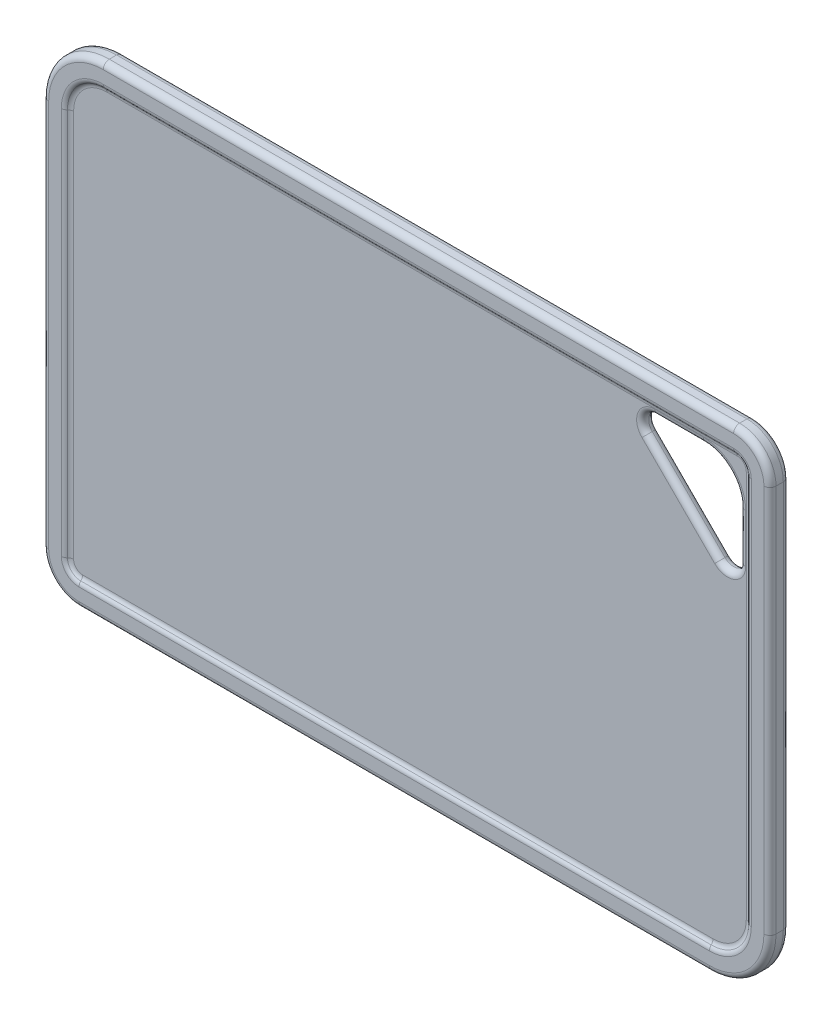
from build123d import *

# Parameters (mm, degrees)
SKETCH1_W           = 381
SKETCH1_H           = 254
BOSS_EXTRUDE1_DEPTH = 3.175
FILLET5_R           = 19.05
FILLET4_R           = 31.75
BOSS_EXTRUDE2_DEPTH = 1.905
CUT_EXTRUDE1_DEPTH  = 230.101276786
FILLET9_R           = 3.175
FILLET8_R           = 3.175


with BuildPart() as part:
    # Sketch1 → Boss-Extrude1 (new, symmetric)
    with BuildSketch(Plane.XY):
        Rectangle(SKETCH1_W, SKETCH1_H)
    extrude(amount=BOSS_EXTRUDE1_DEPTH, both=True)

    # Fillet5
    fillet5_edges = [part.edges().sort_by_distance(p)[0] for p in [
        (-190.5, -127, 0),
        (190.5, 127, 0),
    ]]
    fillet(fillet5_edges, radius=FILLET5_R)

    # Fillet4
    fillet4_edges = [part.edges().sort_by_distance(p)[0] for p in [
        (190.5, -127, 0),
        (-190.5, 127, 0),
    ]]
    fillet(fillet4_edges, radius=FILLET4_R)

    # Sketch2 → Boss-Extrude2 (add)
    with BuildSketch(Plane.XY.offset(3.175)):
        with BuildLine():
            Line((-171.45, -127), (158.75, -127))
            ThreePointArc((158.75, -127), (181.200640303, -117.700640303), (190.5, -95.25))
            Line((190.5, -95.25), (190.5, 107.95))
            ThreePointArc((190.5, 107.95), (184.920384182, 121.420384182), (171.45, 127))
            Line((171.45, 127), (-158.75, 127))
            ThreePointArc((-158.75, 127), (-181.200640303, 117.700640303), (-190.5, 95.25))
            Line((-190.5, 95.25), (-190.5, -107.95))
            ThreePointArc((-190.5, -107.95), (-184.920384182, -121.420384182), (-171.45, -127))
        make_face()
        with BuildLine():
            Line((-171.45, -114.3), (158.75, -114.3))
            ThreePointArc((158.75, -114.3), (172.220384182, -108.720384182), (177.8, -95.25))
            Line((177.8, -95.25), (177.8, 107.95))
            ThreePointArc((177.8, 107.95), (175.940128061, 112.440128061), (171.45, 114.3))
            Line((171.45, 114.3), (-158.75, 114.3))
            ThreePointArc((-158.75, 114.3), (-172.220384182, 108.720384182), (-177.8, 95.25))
            Line((-177.8, 95.25), (-177.8, -107.95))
            ThreePointArc((-177.8, -107.95), (-175.940128061, -112.440128061), (-171.45, -114.3))
        make_face(mode=Mode.SUBTRACT)
    boss_extrude2 = extrude(amount=BOSS_EXTRUDE2_DEPTH)

    # Mirror1: Boss-Extrude2 across plane
    add(boss_extrude2.mirror(Plane.XY))

    # Sketch3 → Cut-Extrude1 (cut, through all)
    with BuildSketch(Plane.XY.offset(3.175)):
        with BuildLine():
            Line((153.67, 109.22), (128.27, 109.22))
            ThreePointArc((128.27, 109.22), (122.403364969, 105.300039796), (123.779871939, 98.379871939))
            Line((123.779871939, 98.379871939), (161.879871939, 60.279871939))
            ThreePointArc((161.879871939, 60.279871939), (168.800039796, 58.903364969), (172.72, 64.77))
            Line((172.72, 64.77), (172.72, 90.17))
            ThreePointArc((172.72, 90.17), (167.140384182, 103.640384182), (153.67, 109.22))
        make_face()
    extrude(amount=-CUT_EXTRUDE1_DEPTH, mode=Mode.SUBTRACT)

    # Fillet9
    # the kernel refuses this fillet: 3.175 mm, written as the material it takes off along each edge
    with BuildSketch(Plane(origin=(153.67, 109.22, -3.175), x_dir=(0, 1, 0), z_dir=(-1, 0, 0)), Plane(origin=(172.72, 64.77, -3.175), x_dir=(1, 0, 0), z_dir=(0, 1, 0))) as fillet9_piece_1:
        with BuildLine():
            CenterArc((FILLET9_R, -FILLET9_R), FILLET9_R, 90, 90)
            Line((0, -FILLET9_R), (-FILLET9_R * 0.02, -FILLET9_R))
            Line((-FILLET9_R * 0.02, -FILLET9_R), (-FILLET9_R * 0.02, FILLET9_R * 0.02))
            Line((-FILLET9_R * 0.02, FILLET9_R * 0.02), (FILLET9_R, FILLET9_R * 0.02))
            Line((FILLET9_R, FILLET9_R * 0.02), (FILLET9_R, 0))
        make_face()
    extrude(amount=25.4, mode=Mode.SUBTRACT)
    with BuildSketch(Plane(origin=(128.27, 102.87, -3.175), x_dir=(0, 1, 0), z_dir=(1, 0, 0))) as fillet9_piece_2:
        with BuildLine():
            CenterArc((6.35 + FILLET9_R, FILLET9_R), FILLET9_R, 180, 90)
            Line((6.35, FILLET9_R), (6.35 - FILLET9_R * 0.02, FILLET9_R))
            Line((6.35 - FILLET9_R * 0.02, FILLET9_R), (6.35 - FILLET9_R * 0.02, -FILLET9_R * 0.02))
            Line((6.35 - FILLET9_R * 0.02, -FILLET9_R * 0.02), (6.35 + FILLET9_R, -FILLET9_R * 0.02))
            Line((6.35 + FILLET9_R, -FILLET9_R * 0.02), (6.35 + FILLET9_R, 0))
        make_face()
    revolve(axis=Axis((128.27, 102.87, -3.175), (0, 0, 1)), revolution_arc=135, mode=Mode.SUBTRACT)
    with BuildSketch(Plane(origin=(123.779871939, 98.379871939, -3.175), x_dir=(-0.7071067811865436, -0.7071067811865515, 0), z_dir=(0.7071067811865515, -0.7071067811865436, 0))) as fillet9_piece_3:
        with BuildLine():
            CenterArc((FILLET9_R, -FILLET9_R), FILLET9_R, 90, 90)
            Line((0, -FILLET9_R), (-FILLET9_R * 0.02, -FILLET9_R))
            Line((-FILLET9_R * 0.02, -FILLET9_R), (-FILLET9_R * 0.02, FILLET9_R * 0.02))
            Line((-FILLET9_R * 0.02, FILLET9_R * 0.02), (FILLET9_R, FILLET9_R * 0.02))
            Line((FILLET9_R, FILLET9_R * 0.02), (FILLET9_R, 0))
        make_face()
    extrude(amount=53.881536726, mode=Mode.SUBTRACT)
    with BuildSketch(Plane(origin=(166.37, 64.77, -3.175), x_dir=(-0.7071067811865369, -0.7071067811865581, 0), z_dir=(-0.7071067811865581, 0.7071067811865369, 0))) as fillet9_piece_4:
        with BuildLine():
            CenterArc((6.35 + FILLET9_R, FILLET9_R), FILLET9_R, 180, 90)
            Line((6.35, FILLET9_R), (6.35 - FILLET9_R * 0.02, FILLET9_R))
            Line((6.35 - FILLET9_R * 0.02, FILLET9_R), (6.35 - FILLET9_R * 0.02, -FILLET9_R * 0.02))
            Line((6.35 - FILLET9_R * 0.02, -FILLET9_R * 0.02), (6.35 + FILLET9_R, -FILLET9_R * 0.02))
            Line((6.35 + FILLET9_R, -FILLET9_R * 0.02), (6.35 + FILLET9_R, 0))
        make_face()
    revolve(axis=Axis((166.37, 64.77, -3.175), (0, 0, 1)), revolution_arc=135, mode=Mode.SUBTRACT)
    with BuildSketch(Plane(origin=(153.67, 90.17, -3.175), x_dir=(1, 0, 0), z_dir=(0, -1, 0))) as fillet9_piece_5:
        with BuildLine():
            CenterArc((19.05 + FILLET9_R, FILLET9_R), FILLET9_R, 180, 90)
            Line((19.05, FILLET9_R), (19.05 - FILLET9_R * 0.02, FILLET9_R))
            Line((19.05 - FILLET9_R * 0.02, FILLET9_R), (19.05 - FILLET9_R * 0.02, -FILLET9_R * 0.02))
            Line((19.05 - FILLET9_R * 0.02, -FILLET9_R * 0.02), (19.05 + FILLET9_R, -FILLET9_R * 0.02))
            Line((19.05 + FILLET9_R, -FILLET9_R * 0.02), (19.05 + FILLET9_R, 0))
        make_face()
    revolve(axis=Axis((153.67, 90.17, -3.175), (0, 0, 1)), revolution_arc=90, mode=Mode.SUBTRACT)
    with BuildSketch(Plane(origin=(153.67, 90.17, 3.175), x_dir=(1, 0, 0), z_dir=(0, -1, 0))) as fillet9_piece_6:
        with BuildLine():
            CenterArc((19.05 + FILLET9_R, -FILLET9_R), FILLET9_R, 90, 90)
            Line((19.05, -FILLET9_R), (19.05 - FILLET9_R * 0.02, -FILLET9_R))
            Line((19.05 - FILLET9_R * 0.02, -FILLET9_R), (19.05 - FILLET9_R * 0.02, FILLET9_R * 0.02))
            Line((19.05 - FILLET9_R * 0.02, FILLET9_R * 0.02), (19.05 + FILLET9_R, FILLET9_R * 0.02))
            Line((19.05 + FILLET9_R, FILLET9_R * 0.02), (19.05 + FILLET9_R, 0))
        make_face()
    revolve(axis=Axis((153.67, 90.17, 3.175), (0, 0, 1)), revolution_arc=90, mode=Mode.SUBTRACT)
    with BuildSketch(Plane(origin=(153.67, 109.22, 3.175), x_dir=(0, 1, 0), z_dir=(-1, 0, 0)), Plane(origin=(172.72, 64.77, 3.175), x_dir=(1, 0, 0), z_dir=(0, 1, 0))) as fillet9_piece_7:
        with BuildLine():
            CenterArc((FILLET9_R, FILLET9_R), FILLET9_R, 180, 90)
            Line((0, FILLET9_R), (-FILLET9_R * 0.02, FILLET9_R))
            Line((-FILLET9_R * 0.02, FILLET9_R), (-FILLET9_R * 0.02, -FILLET9_R * 0.02))
            Line((-FILLET9_R * 0.02, -FILLET9_R * 0.02), (FILLET9_R, -FILLET9_R * 0.02))
            Line((FILLET9_R, -FILLET9_R * 0.02), (FILLET9_R, 0))
        make_face()
    extrude(amount=25.4, mode=Mode.SUBTRACT)
    with BuildSketch(Plane(origin=(128.27, 102.87, 3.175), x_dir=(0, 1, 0), z_dir=(1, 0, 0))) as fillet9_piece_8:
        with BuildLine():
            CenterArc((6.35 + FILLET9_R, -FILLET9_R), FILLET9_R, 90, 90)
            Line((6.35, -FILLET9_R), (6.35 - FILLET9_R * 0.02, -FILLET9_R))
            Line((6.35 - FILLET9_R * 0.02, -FILLET9_R), (6.35 - FILLET9_R * 0.02, FILLET9_R * 0.02))
            Line((6.35 - FILLET9_R * 0.02, FILLET9_R * 0.02), (6.35 + FILLET9_R, FILLET9_R * 0.02))
            Line((6.35 + FILLET9_R, FILLET9_R * 0.02), (6.35 + FILLET9_R, 0))
        make_face()
    revolve(axis=Axis((128.27, 102.87, 3.175), (0, 0, 1)), revolution_arc=135, mode=Mode.SUBTRACT)
    with BuildSketch(Plane(origin=(123.779871939, 98.379871939, 3.175), x_dir=(-0.7071067811865436, -0.7071067811865515, 0), z_dir=(0.7071067811865515, -0.7071067811865436, 0))) as fillet9_piece_9:
        with BuildLine():
            CenterArc((FILLET9_R, FILLET9_R), FILLET9_R, 180, 90)
            Line((0, FILLET9_R), (-FILLET9_R * 0.02, FILLET9_R))
            Line((-FILLET9_R * 0.02, FILLET9_R), (-FILLET9_R * 0.02, -FILLET9_R * 0.02))
            Line((-FILLET9_R * 0.02, -FILLET9_R * 0.02), (FILLET9_R, -FILLET9_R * 0.02))
            Line((FILLET9_R, -FILLET9_R * 0.02), (FILLET9_R, 0))
        make_face()
    extrude(amount=53.881536726, mode=Mode.SUBTRACT)
    with BuildSketch(Plane(origin=(166.37, 64.77, 3.175), x_dir=(-0.7071067811865369, -0.7071067811865581, 0), z_dir=(-0.7071067811865581, 0.7071067811865369, 0))) as fillet9_piece_10:
        with BuildLine():
            CenterArc((6.35 + FILLET9_R, -FILLET9_R), FILLET9_R, 90, 90)
            Line((6.35, -FILLET9_R), (6.35 - FILLET9_R * 0.02, -FILLET9_R))
            Line((6.35 - FILLET9_R * 0.02, -FILLET9_R), (6.35 - FILLET9_R * 0.02, FILLET9_R * 0.02))
            Line((6.35 - FILLET9_R * 0.02, FILLET9_R * 0.02), (6.35 + FILLET9_R, FILLET9_R * 0.02))
            Line((6.35 + FILLET9_R, FILLET9_R * 0.02), (6.35 + FILLET9_R, 0))
        make_face()
    revolve(axis=Axis((166.37, 64.77, 3.175), (0, 0, 1)), revolution_arc=135, mode=Mode.SUBTRACT)
    with BuildSketch(Plane(origin=(171.45, 107.95, 5.08), x_dir=(1, 0, 0), z_dir=(0, -1, 0))) as fillet9_piece_11:
        with BuildLine():
            CenterArc((19.05 - FILLET9_R, -FILLET9_R), FILLET9_R, 0, 90)
            Line((19.05, -FILLET9_R), (19.05 + FILLET9_R * 0.02, -FILLET9_R))
            Line((19.05 + FILLET9_R * 0.02, -FILLET9_R), (19.05 + FILLET9_R * 0.02, FILLET9_R * 0.02))
            Line((19.05 + FILLET9_R * 0.02, FILLET9_R * 0.02), (19.05 - FILLET9_R, FILLET9_R * 0.02))
            Line((19.05 - FILLET9_R, FILLET9_R * 0.02), (19.05 - FILLET9_R, 0))
        make_face()
    revolve(axis=Axis((171.45, 107.95, 5.08), (0, 0, 1)), revolution_arc=90, mode=Mode.SUBTRACT)
    with BuildSketch(Plane(origin=(171.45, 127, 5.08), x_dir=(0, -1, 0), z_dir=(-1, 0, 0)), Plane(origin=(-171.45, -127, -5.08), x_dir=(0, 0, 1), z_dir=(1, 0, 0))) as fillet9_piece_12:
        with BuildLine():
            CenterArc((FILLET9_R, -FILLET9_R), FILLET9_R, 90, 90)
            Line((0, -FILLET9_R), (-FILLET9_R * 0.02, -FILLET9_R))
            Line((-FILLET9_R * 0.02, -FILLET9_R), (-FILLET9_R * 0.02, FILLET9_R * 0.02))
            Line((-FILLET9_R * 0.02, FILLET9_R * 0.02), (FILLET9_R, FILLET9_R * 0.02))
            Line((FILLET9_R, FILLET9_R * 0.02), (FILLET9_R, 0))
        make_face()
    extrude(amount=330.2, mode=Mode.SUBTRACT)
    with BuildSketch(Plane(origin=(-158.75, 95.25, 5.08), x_dir=(0, 1, 0), z_dir=(1, 0, 0))) as fillet9_piece_13:
        with BuildLine():
            CenterArc((31.75 - FILLET9_R, -FILLET9_R), FILLET9_R, 0, 90)
            Line((31.75, -FILLET9_R), (31.75 + FILLET9_R * 0.02, -FILLET9_R))
            Line((31.75 + FILLET9_R * 0.02, -FILLET9_R), (31.75 + FILLET9_R * 0.02, FILLET9_R * 0.02))
            Line((31.75 + FILLET9_R * 0.02, FILLET9_R * 0.02), (31.75 - FILLET9_R, FILLET9_R * 0.02))
            Line((31.75 - FILLET9_R, FILLET9_R * 0.02), (31.75 - FILLET9_R, 0))
        make_face()
    revolve(axis=Axis((-158.75, 95.25, 5.08), (0, 0, 1)), revolution_arc=90, mode=Mode.SUBTRACT)
    with BuildSketch(Plane(origin=(-190.5, 95.25, 5.08), x_dir=(1, 0, 0), z_dir=(0, -1, 0)), Plane(origin=(190.5, -95.25, 5.08), x_dir=(-1, 0, 0), z_dir=(0, 1, 0))) as fillet9_piece_14:
        with BuildLine():
            CenterArc((FILLET9_R, -FILLET9_R), FILLET9_R, 90, 90)
            Line((0, -FILLET9_R), (-FILLET9_R * 0.02, -FILLET9_R))
            Line((-FILLET9_R * 0.02, -FILLET9_R), (-FILLET9_R * 0.02, FILLET9_R * 0.02))
            Line((-FILLET9_R * 0.02, FILLET9_R * 0.02), (FILLET9_R, FILLET9_R * 0.02))
            Line((FILLET9_R, FILLET9_R * 0.02), (FILLET9_R, 0))
        make_face()
    extrude(amount=203.2, mode=Mode.SUBTRACT)
    with BuildSketch(Plane(origin=(-171.45, -107.95, 5.08), x_dir=(-1, 0, 0), z_dir=(0, 1, 0))) as fillet9_piece_15:
        with BuildLine():
            CenterArc((19.05 - FILLET9_R, -FILLET9_R), FILLET9_R, 0, 90)
            Line((19.05, -FILLET9_R), (19.05 + FILLET9_R * 0.02, -FILLET9_R))
            Line((19.05 + FILLET9_R * 0.02, -FILLET9_R), (19.05 + FILLET9_R * 0.02, FILLET9_R * 0.02))
            Line((19.05 + FILLET9_R * 0.02, FILLET9_R * 0.02), (19.05 - FILLET9_R, FILLET9_R * 0.02))
            Line((19.05 - FILLET9_R, FILLET9_R * 0.02), (19.05 - FILLET9_R, 0))
        make_face()
    revolve(axis=Axis((-171.45, -107.95, 5.08), (0, 0, 1)), revolution_arc=90, mode=Mode.SUBTRACT)
    with BuildSketch(Plane(origin=(-171.45, -127, 5.08), x_dir=(0, 0, -1), z_dir=(1, 0, 0)), Plane(origin=(171.45, 127, -5.08), x_dir=(0, -1, 0), z_dir=(-1, 0, 0))) as fillet9_piece_16:
        with BuildLine():
            CenterArc((FILLET9_R, FILLET9_R), FILLET9_R, 180, 90)
            Line((0, FILLET9_R), (-FILLET9_R * 0.02, FILLET9_R))
            Line((-FILLET9_R * 0.02, FILLET9_R), (-FILLET9_R * 0.02, -FILLET9_R * 0.02))
            Line((-FILLET9_R * 0.02, -FILLET9_R * 0.02), (FILLET9_R, -FILLET9_R * 0.02))
            Line((FILLET9_R, -FILLET9_R * 0.02), (FILLET9_R, 0))
        make_face()
    extrude(amount=330.2, mode=Mode.SUBTRACT)
    with BuildSketch(Plane(origin=(158.75, -95.25, 5.08), x_dir=(0, -1, 0), z_dir=(-1, 0, 0))) as fillet9_piece_17:
        with BuildLine():
            CenterArc((31.75 - FILLET9_R, -FILLET9_R), FILLET9_R, 0, 90)
            Line((31.75, -FILLET9_R), (31.75 + FILLET9_R * 0.02, -FILLET9_R))
            Line((31.75 + FILLET9_R * 0.02, -FILLET9_R), (31.75 + FILLET9_R * 0.02, FILLET9_R * 0.02))
            Line((31.75 + FILLET9_R * 0.02, FILLET9_R * 0.02), (31.75 - FILLET9_R, FILLET9_R * 0.02))
            Line((31.75 - FILLET9_R, FILLET9_R * 0.02), (31.75 - FILLET9_R, 0))
        make_face()
    revolve(axis=Axis((158.75, -95.25, 5.08), (0, 0, 1)), revolution_arc=90, mode=Mode.SUBTRACT)
    with BuildSketch(Plane(origin=(171.45, 107.95, -5.08), x_dir=(1, 0, 0), z_dir=(0, -1, 0))) as fillet9_piece_18:
        with BuildLine():
            CenterArc((19.05 - FILLET9_R, FILLET9_R), FILLET9_R, 270, 90)
            Line((19.05, FILLET9_R), (19.05 + FILLET9_R * 0.02, FILLET9_R))
            Line((19.05 + FILLET9_R * 0.02, FILLET9_R), (19.05 + FILLET9_R * 0.02, -FILLET9_R * 0.02))
            Line((19.05 + FILLET9_R * 0.02, -FILLET9_R * 0.02), (19.05 - FILLET9_R, -FILLET9_R * 0.02))
            Line((19.05 - FILLET9_R, -FILLET9_R * 0.02), (19.05 - FILLET9_R, 0))
        make_face()
    revolve(axis=Axis((171.45, 107.95, -5.08), (0, 0, 1)), revolution_arc=90, mode=Mode.SUBTRACT)
    with BuildSketch(Plane(origin=(190.5, -95.25, -5.08), x_dir=(-1, 0, 0), z_dir=(0, 1, 0)), Plane(origin=(-190.5, 95.25, -5.08), x_dir=(1, 0, 0), z_dir=(0, -1, 0))) as fillet9_piece_19:
        with BuildLine():
            CenterArc((FILLET9_R, FILLET9_R), FILLET9_R, 180, 90)
            Line((0, FILLET9_R), (-FILLET9_R * 0.02, FILLET9_R))
            Line((-FILLET9_R * 0.02, FILLET9_R), (-FILLET9_R * 0.02, -FILLET9_R * 0.02))
            Line((-FILLET9_R * 0.02, -FILLET9_R * 0.02), (FILLET9_R, -FILLET9_R * 0.02))
            Line((FILLET9_R, -FILLET9_R * 0.02), (FILLET9_R, 0))
        make_face()
    extrude(amount=203.2, mode=Mode.SUBTRACT)
    with BuildSketch(Plane(origin=(158.75, -95.25, -5.08), x_dir=(0, -1, 0), z_dir=(-1, 0, 0))) as fillet9_piece_20:
        with BuildLine():
            CenterArc((31.75 - FILLET9_R, FILLET9_R), FILLET9_R, 270, 90)
            Line((31.75, FILLET9_R), (31.75 + FILLET9_R * 0.02, FILLET9_R))
            Line((31.75 + FILLET9_R * 0.02, FILLET9_R), (31.75 + FILLET9_R * 0.02, -FILLET9_R * 0.02))
            Line((31.75 + FILLET9_R * 0.02, -FILLET9_R * 0.02), (31.75 - FILLET9_R, -FILLET9_R * 0.02))
            Line((31.75 - FILLET9_R, -FILLET9_R * 0.02), (31.75 - FILLET9_R, 0))
        make_face()
    revolve(axis=Axis((158.75, -95.25, -5.08), (0, 0, 1)), revolution_arc=90, mode=Mode.SUBTRACT)
    with BuildSketch(Plane(origin=(-171.45, -107.95, -5.08), x_dir=(-1, 0, 0), z_dir=(0, 1, 0))) as fillet9_piece_21:
        with BuildLine():
            CenterArc((19.05 - FILLET9_R, FILLET9_R), FILLET9_R, 270, 90)
            Line((19.05 - FILLET9_R, 0), (19.05 - FILLET9_R, -FILLET9_R * 0.02))
            Line((19.05 - FILLET9_R, -FILLET9_R * 0.02), (19.05 + FILLET9_R * 0.02, -FILLET9_R * 0.02))
            Line((19.05 + FILLET9_R * 0.02, -FILLET9_R * 0.02), (19.05 + FILLET9_R * 0.02, FILLET9_R))
            Line((19.05 + FILLET9_R * 0.02, FILLET9_R), (19.05, FILLET9_R))
        make_face()
    revolve(axis=Axis((-171.45, -107.95, -5.08), (0, 0, 1)), revolution_arc=90, mode=Mode.SUBTRACT)
    with BuildSketch(Plane(origin=(-158.75, 95.25, -5.08), x_dir=(0, 1, 0), z_dir=(1, 0, 0))) as fillet9_piece_22:
        with BuildLine():
            CenterArc((31.75 - FILLET9_R, FILLET9_R), FILLET9_R, 270, 90)
            Line((31.75, FILLET9_R), (31.75 + FILLET9_R * 0.02, FILLET9_R))
            Line((31.75 + FILLET9_R * 0.02, FILLET9_R), (31.75 + FILLET9_R * 0.02, -FILLET9_R * 0.02))
            Line((31.75 + FILLET9_R * 0.02, -FILLET9_R * 0.02), (31.75 - FILLET9_R, -FILLET9_R * 0.02))
            Line((31.75 - FILLET9_R, -FILLET9_R * 0.02), (31.75 - FILLET9_R, 0))
        make_face()
    revolve(axis=Axis((-158.75, 95.25, -5.08), (0, 0, 1)), revolution_arc=90, mode=Mode.SUBTRACT)
    with BuildSketch(Plane(origin=(171.45, 107.95, 5.08), x_dir=(1, 0, 0), z_dir=(0, -1, 0))) as fillet9_piece_23:
        with BuildLine():
            CenterArc((9.259935566, -3.175), FILLET9_R, 90, 66.421821522)
            Line((6.35, -1.905), (6.291801289, -1.8796))
            ThreePointArc((6.291801289, -1.8796), (6.2865, -0.9525), (6.2865, 0))
            Line((6.2865, 0), (6.35, 0.0635))
            Line((6.35, 0.0635), (9.259935566, 0.0635))
            Line((9.259935566, 0.0635), (9.259935566, 0))
        make_face()
    revolve(axis=Axis((171.45, 107.95, 5.08), (0, 0, 1)), revolution_arc=90, mode=Mode.SUBTRACT)
    with BuildSketch(Plane(origin=(171.45, 114.3, 5.08), x_dir=(0, 1, 0), z_dir=(-1, 0, 0)), Plane(origin=(-171.45, -114.3, 5.08), x_dir=(0, -1, 0), z_dir=(1, 0, 0))) as fillet9_piece_24:
        with BuildLine():
            CenterArc((2.909935566, 3.175), FILLET9_R, 203.578178478, 66.421821522)
            Line((0, 1.905), (-0.058198711, 1.8796))
            ThreePointArc((-0.058198711, 1.8796), (-0.0635, 0.9525), (-0.0635, 0))
            Line((-0.0635, 0), (0, -0.0635))
            Line((0, -0.0635), (2.909935566, -0.0635))
            Line((2.909935566, -0.0635), (2.909935566, 0))
        make_face()
    extrude(amount=330.2, mode=Mode.SUBTRACT)
    with BuildSketch(Plane(origin=(-158.75, 95.25, 5.08), x_dir=(0, 1, 0), z_dir=(1, 0, 0))) as fillet9_piece_25:
        with BuildLine():
            CenterArc((21.959935566, -3.175), FILLET9_R, 90, 66.421821522)
            Line((19.05, -1.905), (18.991801289, -1.8796))
            ThreePointArc((18.991801289, -1.8796), (18.9865, -0.9525), (18.9865, 0))
            Line((18.9865, 0), (19.05, 0.0635))
            Line((19.05, 0.0635), (21.959935566, 0.0635))
            Line((21.959935566, 0.0635), (21.959935566, 0))
        make_face()
    revolve(axis=Axis((-158.75, 95.25, 5.08), (0, 0, 1)), revolution_arc=90, mode=Mode.SUBTRACT)
    with BuildSketch(Plane(origin=(-177.8, 95.25, 5.08), x_dir=(-1, 0, 0), z_dir=(0, -1, 0)), Plane(origin=(177.8, -95.25, 5.08), x_dir=(1, 0, 0), z_dir=(0, 1, 0))) as fillet9_piece_26:
        with BuildLine():
            CenterArc((2.909935566, 3.175), FILLET9_R, 203.578178478, 66.421821522)
            Line((0, 1.905), (-0.058198711, 1.8796))
            ThreePointArc((-0.058198711, 1.8796), (-0.0635, 0.9525), (-0.0635, 0))
            Line((-0.0635, 0), (0, -0.0635))
            Line((0, -0.0635), (2.909935566, -0.0635))
            Line((2.909935566, -0.0635), (2.909935566, 0))
        make_face()
    extrude(amount=203.2, mode=Mode.SUBTRACT)
    with BuildSketch(Plane(origin=(-171.45, -107.95, 5.08), x_dir=(-1, 0, 0), z_dir=(0, 1, 0))) as fillet9_piece_27:
        with BuildLine():
            CenterArc((9.259935566, -3.175), FILLET9_R, 90, 66.421821522)
            Line((6.35, -1.905), (6.291801289, -1.8796))
            ThreePointArc((6.291801289, -1.8796), (6.2865, -0.9525), (6.2865, 0))
            Line((6.2865, 0), (6.35, 0.0635))
            Line((6.35, 0.0635), (9.259935566, 0.0635))
            Line((9.259935566, 0.0635), (9.259935566, 0))
        make_face()
    revolve(axis=Axis((-171.45, -107.95, 5.08), (0, 0, 1)), revolution_arc=90, mode=Mode.SUBTRACT)
    with BuildSketch(Plane(origin=(158.75, -95.25, 5.08), x_dir=(0, -1, 0), z_dir=(-1, 0, 0))) as fillet9_piece_28:
        with BuildLine():
            CenterArc((21.959935566, -3.175), FILLET9_R, 90, 66.421821522)
            Line((19.05, -1.905), (18.991801289, -1.8796))
            ThreePointArc((18.991801289, -1.8796), (18.9865, -0.9525), (18.9865, 0))
            Line((18.9865, 0), (19.05, 0.0635))
            Line((19.05, 0.0635), (21.959935566, 0.0635))
            Line((21.959935566, 0.0635), (21.959935566, 0))
        make_face()
    revolve(axis=Axis((158.75, -95.25, 5.08), (0, 0, 1)), revolution_arc=90, mode=Mode.SUBTRACT)
    with BuildSketch(Plane(origin=(171.45, 107.95, -5.08), x_dir=(1, 0, 0), z_dir=(0, -1, 0))) as fillet9_piece_29:
        with BuildLine():
            CenterArc((9.259935566, 3.175), FILLET9_R, 203.578178478, 66.421821522)
            Line((6.35, 1.905), (6.291801289, 1.8796))
            ThreePointArc((6.291801289, 1.8796), (6.2865, 0.9525), (6.2865, 0))
            Line((6.2865, 0), (6.35, -0.0635))
            Line((6.35, -0.0635), (9.259935566, -0.0635))
            Line((9.259935566, -0.0635), (9.259935566, 0))
        make_face()
    revolve(axis=Axis((171.45, 107.95, -5.08), (0, 0, 1)), revolution_arc=90, mode=Mode.SUBTRACT)
    with BuildSketch(Plane(origin=(171.45, 114.3, -5.08), x_dir=(0, 1, 0), z_dir=(-1, 0, 0)), Plane(origin=(-171.45, -114.3, -5.08), x_dir=(0, -1, 0), z_dir=(1, 0, 0))) as fillet9_piece_30:
        with BuildLine():
            CenterArc((2.909935566, -3.175), FILLET9_R, 90, 66.421821522)
            Line((0, -1.905), (-0.058198711, -1.8796))
            ThreePointArc((-0.058198711, -1.8796), (-0.0635, -0.9525), (-0.0635, 0))
            Line((-0.0635, 0), (0, 0.0635))
            Line((0, 0.0635), (2.909935566, 0.0635))
            Line((2.909935566, 0.0635), (2.909935566, 0))
        make_face()
    extrude(amount=330.2, mode=Mode.SUBTRACT)
    with BuildSketch(Plane(origin=(-158.75, 95.25, -5.08), x_dir=(0, 1, 0), z_dir=(1, 0, 0))) as fillet9_piece_31:
        with BuildLine():
            CenterArc((21.959935566, 3.175), FILLET9_R, 203.578178478, 66.421821522)
            Line((19.05, 1.905), (18.991801289, 1.8796))
            ThreePointArc((18.991801289, 1.8796), (18.9865, 0.9525), (18.9865, 0))
            Line((18.9865, 0), (19.05, -0.0635))
            Line((19.05, -0.0635), (21.959935566, -0.0635))
            Line((21.959935566, -0.0635), (21.959935566, 0))
        make_face()
    revolve(axis=Axis((-158.75, 95.25, -5.08), (0, 0, 1)), revolution_arc=90, mode=Mode.SUBTRACT)
    with BuildSketch(Plane(origin=(-177.8, 95.25, -5.08), x_dir=(-1, 0, 0), z_dir=(0, -1, 0)), Plane(origin=(177.8, -95.25, -5.08), x_dir=(1, 0, 0), z_dir=(0, 1, 0))) as fillet9_piece_32:
        with BuildLine():
            CenterArc((2.909935566, -3.175), FILLET9_R, 90, 66.421821522)
            Line((0, -1.905), (-0.058198711, -1.8796))
            ThreePointArc((-0.058198711, -1.8796), (-0.0635, -0.9525), (-0.0635, 0))
            Line((-0.0635, 0), (0, 0.0635))
            Line((0, 0.0635), (2.909935566, 0.0635))
            Line((2.909935566, 0.0635), (2.909935566, 0))
        make_face()
    extrude(amount=203.2, mode=Mode.SUBTRACT)
    with BuildSketch(Plane(origin=(-171.45, -107.95, -5.08), x_dir=(-1, 0, 0), z_dir=(0, 1, 0))) as fillet9_piece_33:
        with BuildLine():
            CenterArc((9.259935566, 3.175), FILLET9_R, 203.578178478, 66.421821522)
            Line((6.35, 1.905), (6.291801289, 1.8796))
            ThreePointArc((6.291801289, 1.8796), (6.2865, 0.9525), (6.2865, 0))
            Line((6.2865, 0), (6.35, -0.0635))
            Line((6.35, -0.0635), (9.259935566, -0.0635))
            Line((9.259935566, -0.0635), (9.259935566, 0))
        make_face()
    revolve(axis=Axis((-171.45, -107.95, -5.08), (0, 0, 1)), revolution_arc=90, mode=Mode.SUBTRACT)
    with BuildSketch(Plane(origin=(158.75, -95.25, -5.08), x_dir=(0, -1, 0), z_dir=(-1, 0, 0))) as fillet9_piece_34:
        with BuildLine():
            CenterArc((21.959935566, 3.175), FILLET9_R, 203.578178478, 66.421821522)
            Line((19.05, 1.905), (18.991801289, 1.8796))
            ThreePointArc((18.991801289, 1.8796), (18.9865, 0.9525), (18.9865, 0))
            Line((18.9865, 0), (19.05, -0.0635))
            Line((19.05, -0.0635), (21.959935566, -0.0635))
            Line((21.959935566, -0.0635), (21.959935566, 0))
        make_face()
    revolve(axis=Axis((158.75, -95.25, -5.08), (0, 0, 1)), revolution_arc=90, mode=Mode.SUBTRACT)

    # Fillet8
    fillet8_edges = [part.edges().sort_by_distance(p)[0] for p in [
        (6.35, 114.3, -3.175),
        (175.940128061, 112.440128061, 3.175),
        (6.35, 114.3, 3.175),
        (-172.220384182, 108.720384182, 3.175),
        (-177.8, -6.35, 3.175),
        (-175.940128061, -112.440128061, 3.175),
        (-6.35, -114.3, 3.175),
        (172.220384182, -108.720384182, 3.175),
        (177.8, 6.35, 3.175),
        (175.940128061, 112.440128061, -3.175),
        (177.8, 6.35, -3.175),
        (172.220384182, -108.720384182, -3.175),
        (-6.35, -114.3, -3.175),
        (-175.940128061, -112.440128061, -3.175),
        (-177.8, -6.35, -3.175),
        (-172.220384182, 108.720384182, -3.175),
    ]]
    fillet(fillet8_edges, radius=FILLET8_R)


solid = part.part
